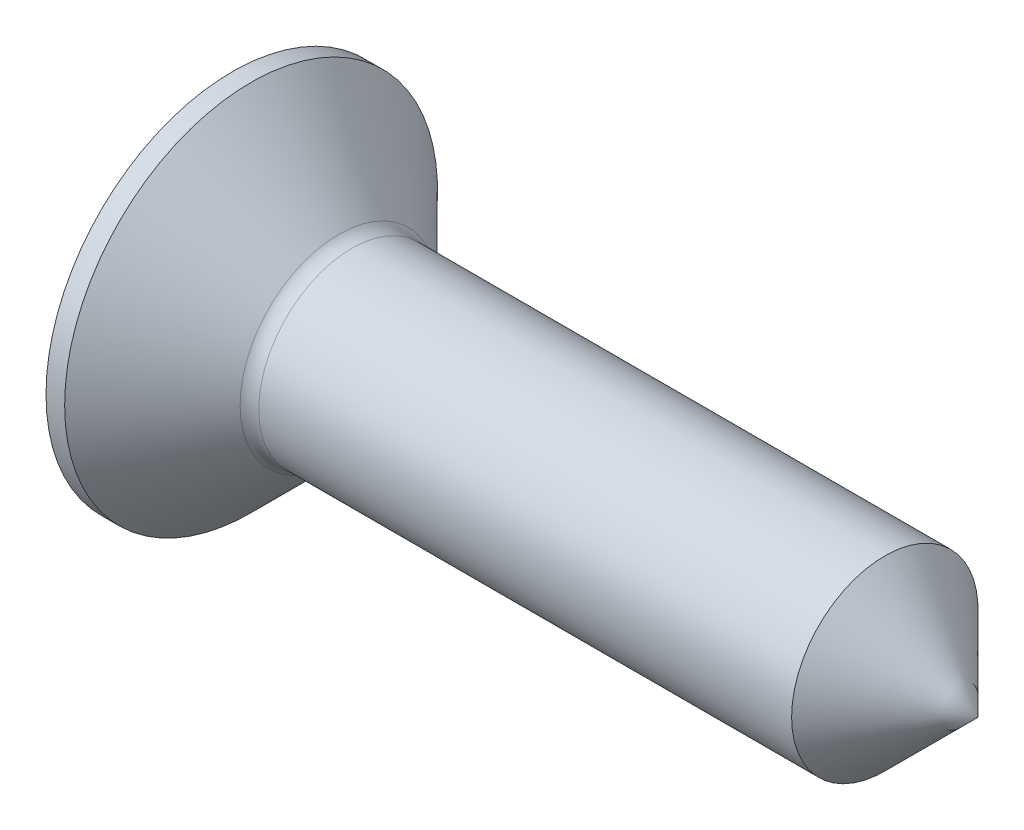
from build123d import *

# Parameters (mm, degrees)
FILLET2_R = 0.2


with BuildPart() as part:
    # Sketch1 → Base (revolve)
    with BuildSketch(Plane(origin=(0, 0, 0), x_dir=(1, 0, 0), z_dir=(0, 1, 0))):
        Polygon((1.2, 1), (8, 1), (8, 0), (0, 0), (0, 2), (0.2, 2), align=None)
    revolve(axis=Axis((-6.506452013, 0, 0), (1, 0, 0)))

    # Sketch3 → Cut-Revolve1 (revolve, cut)
    with BuildSketch(Plane.XY):
        Polygon((8.15755877, 0), (8.15755877, 20), (-12, 20), (8, 0), align=None)
    revolve(axis=Axis((4.883468835, 0, 0), (1, 0, 0)), mode=Mode.SUBTRACT)

    # Fillet2
    fillet2_edges = [part.edges().sort_by_distance(p)[0] for p in [
        (1.2, 0, 1),
    ]]
    fillet(fillet2_edges, radius=FILLET2_R)

    # Sketch2 → Cut-Loft1 section 0
    with BuildSketch(Plane(origin=(0, -0.680816871, 0.306758275), x_dir=(0, 0, 1), z_dir=(-1, 0, 0)), mode=Mode.PRIVATE) as cut_loft1_s0:
        with BuildLine():
            Line((-0.556758275, 0.930816871), (-1.556758275, 0.930816871))
            Line((-1.556758275, 0.930816871), (-1.556758275, 0.430816871))
            Line((-1.556758275, 0.430816871), (-0.556758275, 0.430816871))
            Line((-0.556758275, 0.430816871), (-0.556758275, -0.569183129))
            Line((-0.556758275, -0.569183129), (-0.056758275, -0.569183129))
            Line((-0.056758275, -0.569183129), (-0.056758275, 0.430816871))
            Line((-0.056758275, 0.430816871), (0.943241725, 0.430816871))
            Line((0.943241725, 0.430816871), (0.943241725, 0.930816871))
            Line((0.943241725, 0.930816871), (-0.056758275, 0.930816871))
            Line((-0.056758275, 0.930816871), (-0.056758275, 1.930816871))
            Line((-0.056758275, 1.930816871), (-0.556758275, 1.930816871))
            Line((-0.556758275, 1.930816871), (-0.556758275, 0.930816871))
        make_face()
    loft([cut_loft1_s0.sketch, Vertex(1.45, 0, 0)], mode=Mode.SUBTRACT)


solid = part.part
